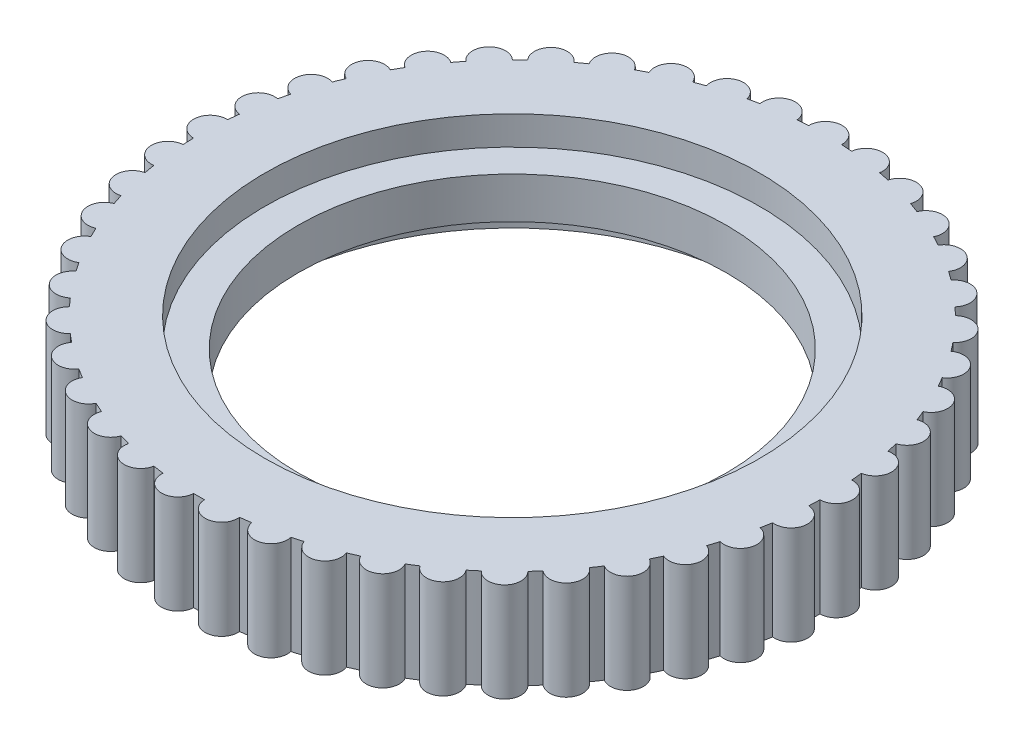
from build123d import *

# Parameters (mm, degrees)
SKETCH1_R           = 15
BOSS_EXTRUDE1_DEPTH = 6
BOSS_EXTRUDE2_START = 1.75
SKETCH1_3_R         = 15
SKETCH1_3_R_2       = 13
BOSS_EXTRUDE2_DEPTH = 2.5


with BuildPart() as part:
    # Sketch1 → Boss-Extrude1 (new body)
    with BuildSketch(Plane(origin=(0, 0, 0), x_dir=(1, 0, 0), z_dir=(0, 1, 0))):
        with BuildLine():
            ThreePointArc((18.997013365, -0.336872688), (19.98781654, 0.697989934), (18.927238544, 1.661216747))
            ThreePointArc((18.927238544, 1.661216747), (18.895916012, 1.986040802), (18.859019353, 2.310278993))
            ThreePointArc((18.859019353, 2.310278993), (19.69615506, 3.472963553), (18.511843274, 4.279212381))
            ThreePointArc((18.511843274, 4.279212381), (18.435618799, 4.596516016), (18.353955982, 4.912463721))
            ThreePointArc((18.353955982, 4.912463721), (19.021130326, 6.180339887), (17.736136031, 6.813918013))
            ThreePointArc((17.736136031, 6.813918013), (17.616493237, 7.117525275), (17.491653735, 7.419032931))
            ThreePointArc((17.491653735, 7.419032931), (17.975880926, 8.767422936), (16.615215075, 9.215998482))
            ThreePointArc((16.615215075, 9.215998482), (16.454482672, 9.5), (16.288896344, 9.781199103))
            ThreePointArc((16.288896344, 9.781199103), (16.580751451, 11.183858069), (15.170897857, 11.438700023))
            ThreePointArc((15.170897857, 11.438700023), (14.972204319, 11.697568031), (14.769094114, 11.952985361))
            ThreePointArc((14.769094114, 11.952985361), (14.86289651, 13.382612127), (13.431296368, 13.43876028))
            ThreePointArc((13.431296368, 13.43876028), (13.198509039, 13.667456206), (12.961828267, 13.892120356))
            ThreePointArc((12.961828267, 13.892120356), (12.855752194, 15.320888862), (11.430269974, 15.177250354))
            ThreePointArc((11.430269974, 15.177250354), (11.167919794, 15.371322893), (10.902275176, 15.560861029))
            ThreePointArc((10.902275176, 15.560861029), (10.598385285, 16.960961923), (9.206766377, 16.620332514))
            ThreePointArc((9.206766377, 16.620332514), (8.919959693, 16.776004264), (8.630521701, 16.926727243))
            ThreePointArc((8.630521701, 16.926727243), (8.134732862, 18.270909153), (6.804063544, 17.739918807))
            ThreePointArc((6.804063544, 17.739918807), (6.498382723, 17.854159795), (6.190784937, 17.963133965))
            ThreePointArc((6.190784937, 17.963133965), (5.512747116, 19.225233919), (4.268927354, 18.514217759))
            ThreePointArc((4.268927354, 18.514217759), (3.950322126, 18.584804414), (3.630551587, 18.649908718))
            ThreePointArc((3.630551587, 18.649908718), (2.783462019, 19.805361375), (1.650701349, 18.928158523))
            ThreePointArc((1.650701349, 18.928158523), (1.325373001, 18.953716955), (0.99965368, 18.973684211))
            ThreePointArc((0.99965368, 18.973684211), (0, 20), (-0.99965368, 18.973684211))
            ThreePointArc((-0.99965368, 18.973684211), (-1.325373001, 18.953716955), (-1.650701349, 18.928158523))
            ThreePointArc((-1.650701349, 18.928158523), (-2.783462019, 19.805361375), (-3.630551587, 18.649908718))
            ThreePointArc((-3.630551587, 18.649908718), (-3.950322126, 18.584804414), (-4.268927354, 18.514217759))
            ThreePointArc((-4.268927354, 18.514217759), (-5.512747116, 19.225233919), (-6.190784937, 17.963133965))
            ThreePointArc((-6.190784937, 17.963133965), (-6.498382723, 17.854159795), (-6.804063544, 17.739918807))
            ThreePointArc((-6.804063544, 17.739918807), (-8.134732862, 18.270909153), (-8.630521701, 16.926727243))
            ThreePointArc((-8.630521701, 16.926727243), (-8.919959693, 16.776004264), (-9.206766377, 16.620332514))
            ThreePointArc((-9.206766377, 16.620332514), (-10.598385285, 16.960961923), (-10.902275176, 15.560861029))
            ThreePointArc((-10.902275176, 15.560861029), (-11.167919794, 15.371322893), (-11.430269974, 15.177250354))
            ThreePointArc((-11.430269974, 15.177250354), (-12.855752194, 15.320888862), (-12.961828267, 13.892120356))
            ThreePointArc((-12.961828267, 13.892120356), (-13.198509039, 13.667456206), (-13.431296368, 13.43876028))
            ThreePointArc((-13.431296368, 13.43876028), (-14.86289651, 13.382612127), (-14.769094114, 11.952985361))
            ThreePointArc((-14.769094114, 11.952985361), (-14.972204319, 11.697568031), (-15.170897857, 11.438700023))
            ThreePointArc((-15.170897857, 11.438700023), (-16.580751451, 11.183858069), (-16.288896344, 9.781199103))
            ThreePointArc((-16.288896344, 9.781199103), (-16.454482672, 9.5), (-16.615215075, 9.215998482))
            ThreePointArc((-16.615215075, 9.215998482), (-17.975880926, 8.767422936), (-17.491653735, 7.419032931))
            ThreePointArc((-17.491653735, 7.419032931), (-17.616493237, 7.117525275), (-17.736136031, 6.813918013))
            ThreePointArc((-17.736136031, 6.813918013), (-19.021130326, 6.180339887), (-18.353955982, 4.912463721))
            ThreePointArc((-18.353955982, 4.912463721), (-18.435618799, 4.596516016), (-18.511843274, 4.279212381))
            ThreePointArc((-18.511843274, 4.279212381), (-19.69615506, 3.472963553), (-18.859019353, 2.310278993))
            ThreePointArc((-18.859019353, 2.310278993), (-18.895916012, 1.986040802), (-18.927238544, 1.661216747))
            ThreePointArc((-18.927238544, 1.661216747), (-19.98781654, 0.697989934), (-18.997013365, -0.336872688))
            ThreePointArc((-18.997013365, -0.336872688), (-18.988425713, -0.663090437), (-18.974236646, -0.989112581))
            ThreePointArc((-18.974236646, -0.989112581), (-19.890437907, -2.090569265), (-18.76525212, -2.977467525))
            ThreePointArc((-18.76525212, -2.977467525), (-18.711347307, -3.299315376), (-18.651922814, -3.620189958))
            ThreePointArc((-18.651922814, -3.620189958), (-19.405914526, -4.838437912), (-18.168246588, -5.560109344))
            ThreePointArc((-18.168246588, -5.560109344), (-18.07007381, -5.871322893), (-17.966570521, -6.180804455))
            ThreePointArc((-17.966570521, -6.180804455), (-18.543677091, -7.492131868), (-17.217616802, -8.034529959))
            ThreePointArc((-17.217616802, -8.034529959), (-17.07708688, -8.329051789), (-16.93151937, -8.621116624))
            ThreePointArc((-16.93151937, -8.621116624), (-17.320508076, -10), (-15.93186569, -10.352567587))
            ThreePointArc((-15.93186569, -10.352567587), (-15.751713879, -10.624665166), (-15.566915453, -10.893628564))
            ThreePointArc((-15.566915453, -10.893628564), (-15.760215072, -12.313229507), (-14.336018934, -12.469104263))
            ThreePointArc((-14.336018934, -12.469104263), (-14.119751684, -12.713481521), (-13.899319234, -12.954108416))
            ThreePointArc((-13.899319234, -12.954108416), (-13.893167409, -14.386796007), (-12.461137877, -14.342944008))
            ThreePointArc((-12.461137877, -14.342944008), (-12.212964584, -14.554844419), (-11.961188576, -14.762451282))
            ThreePointArc((-11.961188576, -14.762451282), (-11.755705046, -16.180339887), (-10.343714945, -15.937614663))
            ThreePointArc((-10.343714945, -15.937614663), (-10.06846602, -16.112913827), (-9.790246988, -16.283459826))
            ThreePointArc((-9.790246988, -16.283459826), (-9.389431256, -17.658951857), (-8.024963368, -17.222077777))
            ThreePointArc((-8.024963368, -17.222077777), (-7.727996218, -17.357363695), (-7.428749379, -17.487529347))
            ThreePointArc((-7.428749379, -17.487529347), (-6.840402867, -18.793852416), (-5.550015007, -18.171332737))
            ThreePointArc((-5.550015007, -18.171332737), (-5.237109761, -18.263972223), (-4.922659614, -18.351224001))
            ThreePointArc((-4.922659614, -18.351224001), (-4.158233816, -19.562952015), (-2.967041917, -18.766903374))
            ThreePointArc((-2.967041917, -18.766903374), (-2.644288918, -18.815093306), (-2.320755878, -18.857732954))
            ThreePointArc((-2.320755878, -18.857732954), (-1.395129475, -19.951281005), (-0.326318731, -18.997197585))
            ThreePointArc((-0.326318731, -18.997197585), (0, -19), (0.326318731, -18.997197585))
            ThreePointArc((0.326318731, -18.997197585), (1.395129475, -19.951281005), (2.320755878, -18.857732954))
            ThreePointArc((2.320755878, -18.857732954), (2.644288918, -18.815093306), (2.967041917, -18.766903374))
            ThreePointArc((2.967041917, -18.766903374), (4.158233816, -19.562952015), (4.922659614, -18.351224001))
            ThreePointArc((4.922659614, -18.351224001), (5.237109761, -18.263972223), (5.550015007, -18.171332737))
            ThreePointArc((5.550015007, -18.171332737), (6.840402867, -18.793852416), (7.428749379, -17.487529347))
            ThreePointArc((7.428749379, -17.487529347), (7.727996218, -17.357363695), (8.024963368, -17.222077777))
            ThreePointArc((8.024963368, -17.222077777), (9.389431256, -17.658951857), (9.790246988, -16.283459826))
            ThreePointArc((9.790246988, -16.283459826), (10.06846602, -16.112913827), (10.343714945, -15.937614663))
            ThreePointArc((10.343714945, -15.937614663), (11.755705046, -16.180339887), (11.961188576, -14.762451282))
            ThreePointArc((11.961188576, -14.762451282), (12.212964584, -14.554844419), (12.461137877, -14.342944008))
            ThreePointArc((12.461137877, -14.342944008), (13.893167409, -14.386796007), (13.899319234, -12.954108416))
            ThreePointArc((13.899319234, -12.954108416), (14.119751684, -12.713481521), (14.336018934, -12.469104263))
            ThreePointArc((14.336018934, -12.469104263), (15.760215072, -12.313229507), (15.566915453, -10.893628564))
            ThreePointArc((15.566915453, -10.893628564), (15.751713879, -10.624665166), (15.93186569, -10.352567587))
            ThreePointArc((15.93186569, -10.352567587), (17.320508076, -10), (16.93151937, -8.621116624))
            ThreePointArc((16.93151937, -8.621116624), (17.07708688, -8.329051789), (17.217616802, -8.034529959))
            ThreePointArc((17.217616802, -8.034529959), (18.543677091, -7.492131868), (17.966570521, -6.180804455))
            ThreePointArc((17.966570521, -6.180804455), (18.07007381, -5.871322893), (18.168246588, -5.560109344))
            ThreePointArc((18.168246588, -5.560109344), (19.405914526, -4.838437912), (18.651922814, -3.620189958))
            ThreePointArc((18.651922814, -3.620189958), (18.711347307, -3.299315376), (18.76525212, -2.977467525))
            ThreePointArc((18.76525212, -2.977467525), (19.890437907, -2.090569265), (18.974236646, -0.989112581))
            ThreePointArc((18.974236646, -0.989112581), (18.988425713, -0.663090437), (18.997013365, -0.336872688))
        make_face()
        Circle(SKETCH1_R, mode=Mode.SUBTRACT)
    extrude(amount=BOSS_EXTRUDE1_DEPTH)

    # Sketch1<3> → Boss-Extrude2 (add)
    with BuildSketch(Plane(origin=(0, 0, 0), x_dir=(1, 0, 0), z_dir=(0, 1, 0)).offset(BOSS_EXTRUDE2_START)):
        Circle(SKETCH1_3_R)
        Circle(SKETCH1_3_R_2, mode=Mode.SUBTRACT)
    extrude(amount=BOSS_EXTRUDE2_DEPTH)


solid = part.part
